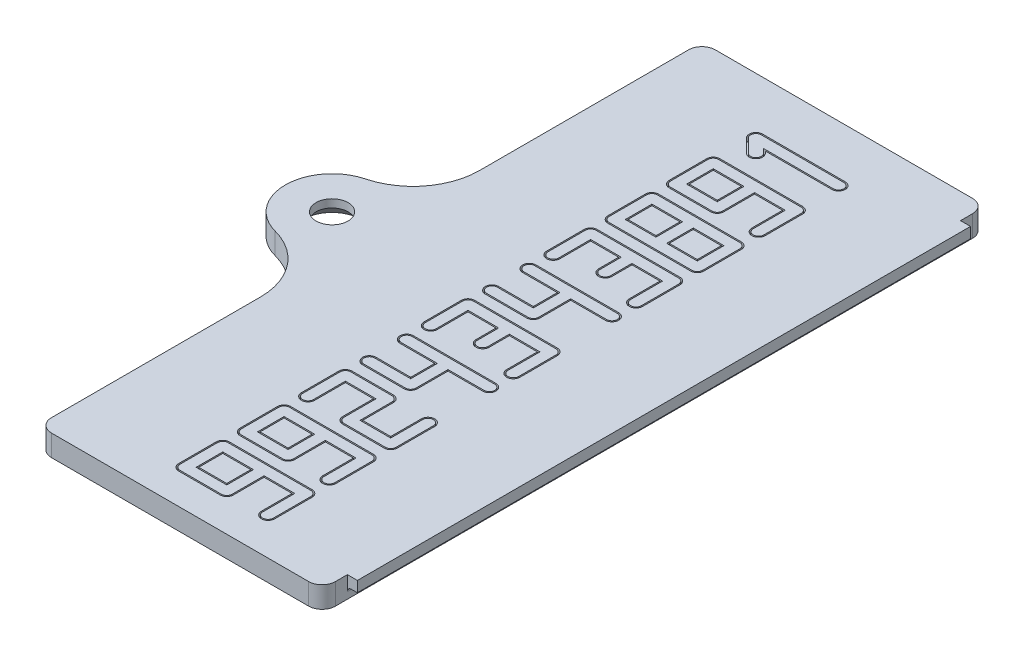
from build123d import *

# Parameters (mm, degrees)
DOOR_PLATE_1_6_SCREW_EAR_R5_R3_5_DEPTH        = 1.6
HOOK_FLANGE_0_75_X_0_8_INNER_FACE_P_2_W       = 0.9
HOOK_FLANGE_0_75_X_0_8_INNER_FACE_P_2_H       = 46
HOOK_FLANGE_0_75_X_0_8_INNER_FACE_PLANE_DEPTH = 0.8
SCREW_HOLE_2_4_FREE_SKETCH_R                  = 1.2
SCREW_HOLE_2_4_FREE_DEPTH                     = 73.114700304
SCREW_CSK_90DEG_M2_SIZE                       = 1
DOOR_CORNERS_R1_PRINT_R                       = 1
HOOK_FLANGE_ROOT_FILLET_R0_3_R                = 0.3
PHONE_NUMBER_9924343891_SLITS_0_8_STROK_DEPTH = 0.4
PHONE_NUMBER_COUNTER_SLITS_SKETCH_W           = 2.3
PHONE_NUMBER_COUNTER_SLITS_SKETCH_H           = 2
PHONE_NUMBER_COUNTER_SLITS_SKETCH_W_2         = 2.1
PHONE_NUMBER_COUNTER_SLITS_SKETCH_H_2         = 1.8
PHONE_NUMBER_COUNTER_SLITS_DEPTH              = 0.4


with BuildPart() as part:
    # Door Plate 1.6 + screw ear (R5 / R3.5) Sketch → Door Plate 1.6 + screw ear (R5 / R3.5) (new body)
    with BuildSketch(Plane(origin=(0, 0, 0), x_dir=(1, 0, 0), z_dir=(0, 1, 0))):
        with BuildLine():
            Line((9.35, 15.1), (30.65, 15.1))
            Line((30.65, 15.1), (30.65, 64.9))
            Line((30.65, 64.9), (9.35, 64.9))
            Line((9.35, 64.9), (9.35, 48.223594105))
            ThreePointArc((9.35, 48.223594105), (8.307494751, 45.167741475), (5.614705882, 43.386185808))
            ThreePointArc((5.614705882, 43.386185808), (3, 40), (5.614705882, 36.613814192))
            ThreePointArc((5.614705882, 36.613814192), (8.307494751, 34.832258525), (9.35, 31.776405895))
            Line((9.35, 31.776405895), (9.35, 15.1))
        make_face()
    extrude(amount=DOOR_PLATE_1_6_SCREW_EAR_R5_R3_5_DEPTH)

    # Hook Flange 0.75 x 0.8 _inner-face p 2 → Hook Flange 0.75 x 0.8 _inner-face plane (add)
    with BuildSketch(Plane(origin=(0, 0.8, 0), x_dir=(1, 0, 0), z_dir=(0, 1, 0))):
        with Locations((30.95, 40)):
            Rectangle(HOOK_FLANGE_0_75_X_0_8_INNER_FACE_P_2_W, HOOK_FLANGE_0_75_X_0_8_INNER_FACE_P_2_H)
    extrude(amount=HOOK_FLANGE_0_75_X_0_8_INNER_FACE_PLANE_DEPTH)

    # Screw Hole 2.4 (free) Sketch → Screw Hole 2.4 (free) (cut, through all)
    with BuildSketch(Plane(origin=(0, 0, 0), x_dir=(1, 0, 0), z_dir=(0, 1, 0))):
        with Locations((6.5, 40)):
            Circle(SCREW_HOLE_2_4_FREE_SKETCH_R)
    extrude(amount=SCREW_HOLE_2_4_FREE_DEPTH, mode=Mode.SUBTRACT)

    # Screw CSK 90deg (M2)
    screw_csk_90deg_m2_edges = [part.edges().sort_by_distance(p)[0] for p in [
        (5.3, 0, -40),
    ]]
    chamfer(screw_csk_90deg_m2_edges, length=SCREW_CSK_90DEG_M2_SIZE)

    # Door Corners R1 (print)
    door_corners_r1_print_edges = [part.edges().sort_by_distance(p)[0] for p in [
        (9.35, 0.8, -64.9),
        (30.65, 0.8, -64.9),
        (30.65, 0.8, -15.1),
        (9.35, 0.8, -15.1),
    ]]
    fillet(door_corners_r1_print_edges, radius=DOOR_CORNERS_R1_PRINT_R)

    # Hook Flange Root Fillet R0.3
    hook_flange_root_fillet_r0_3_edges = [part.edges().sort_by_distance(p)[0] for p in [
        (30.65, 0.8, -40),
    ]]
    fillet(hook_flange_root_fillet_r0_3_edges, radius=HOOK_FLANGE_ROOT_FILLET_R0_3_R)

    # Phone Number 9924343891 Slits _0.8 s 2 → Phone Number 9924343891 Slits _0.8 strok (cut)
    # profile 1 of 10: a face of its own
    with BuildSketch(Plane(origin=(0, 1.6, 0), x_dir=(1, 0, 0), z_dir=(0, 1, 0))):
        with BuildLine():
            Line((20.7, 17.4), (17.6, 17.4))
            ThreePointArc((17.6, 17.4), (17.246446609, 17.546446609), (17.1, 17.9))
            Line((17.1, 17.9), (17.1, 20.7))
            ThreePointArc((17.1, 20.7), (17.246446609, 21.053553391), (17.6, 21.2))
            Line((17.6, 21.2), (23.8, 21.2))
            ThreePointArc((23.8, 21.2), (24.153553391, 21.053553391), (24.3, 20.7))
            Line((24.3, 20.7), (24.3, 17.9))
            ThreePointArc((24.3, 17.9), (23.8, 17.4), (23.3, 17.9))
            Line((23.3, 17.9), (23.3, 20.2))
            Line((23.3, 20.2), (21.2, 20.2))
            Line((21.2, 20.2), (21.2, 17.9))
            ThreePointArc((21.2, 17.9), (21.053553391, 17.546446609), (20.7, 17.4))
        make_face()
        with BuildLine():
            Line((17.2, 20.7), (17.2, 17.9))
            ThreePointArc((17.2, 17.9), (17.317157288, 17.617157288), (17.6, 17.5))
            Line((17.6, 17.5), (20.7, 17.5))
            ThreePointArc((20.7, 17.5), (20.982842712, 17.617157288), (21.1, 17.9))
            Line((21.1, 17.9), (21.1, 20.3))
            Line((21.1, 20.3), (23.4, 20.3))
            Line((23.4, 20.3), (23.4, 17.9))
            ThreePointArc((23.4, 17.9), (23.8, 17.5), (24.2, 17.9))
            Line((24.2, 17.9), (24.2, 20.7))
            ThreePointArc((24.2, 20.7), (24.082842712, 20.982842712), (23.8, 21.1))
            Line((23.8, 21.1), (17.6, 21.1))
            ThreePointArc((17.6, 21.1), (17.317157288, 20.982842712), (17.2, 20.7))
        make_face(mode=Mode.SUBTRACT)
    # profile 2 of 10: a face of its own
    with BuildSketch(Plane(origin=(0, 1.6, 0), x_dir=(1, 0, 0), z_dir=(0, 1, 0))):
        with BuildLine():
            Line((20.7, 22), (17.6, 22))
            ThreePointArc((17.6, 22), (17.246446609, 22.146446609), (17.1, 22.5))
            Line((17.1, 22.5), (17.1, 25.3))
            ThreePointArc((17.1, 25.3), (17.246446609, 25.653553391), (17.6, 25.8))
            Line((17.6, 25.8), (23.8, 25.8))
            ThreePointArc((23.8, 25.8), (24.153553391, 25.653553391), (24.3, 25.3))
            Line((24.3, 25.3), (24.3, 22.5))
            ThreePointArc((24.3, 22.5), (23.8, 22), (23.3, 22.5))
            Line((23.3, 22.5), (23.3, 24.8))
            Line((23.3, 24.8), (21.2, 24.8))
            Line((21.2, 24.8), (21.2, 22.5))
            ThreePointArc((21.2, 22.5), (21.053553391, 22.146446609), (20.7, 22))
        make_face()
        with BuildLine():
            Line((17.2, 25.3), (17.2, 22.5))
            ThreePointArc((17.2, 22.5), (17.317157288, 22.217157288), (17.6, 22.1))
            Line((17.6, 22.1), (20.7, 22.1))
            ThreePointArc((20.7, 22.1), (20.982842712, 22.217157288), (21.1, 22.5))
            Line((21.1, 22.5), (21.1, 24.9))
            Line((21.1, 24.9), (23.4, 24.9))
            Line((23.4, 24.9), (23.4, 22.5))
            ThreePointArc((23.4, 22.5), (23.8, 22.1), (24.2, 22.5))
            Line((24.2, 22.5), (24.2, 25.3))
            ThreePointArc((24.2, 25.3), (24.082842712, 25.582842712), (23.8, 25.7))
            Line((23.8, 25.7), (17.6, 25.7))
            ThreePointArc((17.6, 25.7), (17.317157288, 25.582842712), (17.2, 25.3))
        make_face(mode=Mode.SUBTRACT)
    # profile 3 of 10: a face of its own
    with BuildSketch(Plane(origin=(0, 1.6, 0), x_dir=(1, 0, 0), z_dir=(0, 1, 0))):
        with BuildLine():
            Line((24.3, 29.9), (24.3, 27.1))
            ThreePointArc((24.3, 27.1), (24.153553391, 26.746446609), (23.8, 26.6))
            Line((23.8, 26.6), (20.7, 26.6))
            ThreePointArc((20.7, 26.6), (20.346446609, 26.746446609), (20.2, 27.1))
            Line((20.2, 27.1), (20.2, 29.4))
            Line((20.2, 29.4), (18.1, 29.4))
            Line((18.1, 29.4), (18.1, 27.1))
            ThreePointArc((18.1, 27.1), (17.6, 26.6), (17.1, 27.1))
            Line((17.1, 27.1), (17.1, 29.9))
            ThreePointArc((17.1, 29.9), (17.246446609, 30.253553391), (17.6, 30.4))
            Line((17.6, 30.4), (20.7, 30.4))
            ThreePointArc((20.7, 30.4), (21.053553391, 30.253553391), (21.2, 29.9))
            Line((21.2, 29.9), (21.2, 27.6))
            Line((21.2, 27.6), (23.3, 27.6))
            Line((23.3, 27.6), (23.3, 29.9))
            ThreePointArc((23.3, 29.9), (23.8, 30.4), (24.3, 29.9))
        make_face()
        with BuildLine():
            Line((18, 29.5), (18, 27.1))
            ThreePointArc((18, 27.1), (17.6, 26.7), (17.2, 27.1))
            Line((17.2, 27.1), (17.2, 29.9))
            ThreePointArc((17.2, 29.9), (17.317157288, 30.182842712), (17.6, 30.3))
            Line((17.6, 30.3), (20.7, 30.3))
            ThreePointArc((20.7, 30.3), (20.982842712, 30.182842712), (21.1, 29.9))
            Line((21.1, 29.9), (21.1, 27.5))
            Line((21.1, 27.5), (23.4, 27.5))
            Line((23.4, 27.5), (23.4, 29.9))
            ThreePointArc((23.4, 29.9), (23.8, 30.3), (24.2, 29.9))
            Line((24.2, 29.9), (24.2, 27.1))
            ThreePointArc((24.2, 27.1), (24.082842712, 26.817157288), (23.8, 26.7))
            Line((23.8, 26.7), (20.7, 26.7))
            ThreePointArc((20.7, 26.7), (20.417157288, 26.817157288), (20.3, 27.1))
            Line((20.3, 27.1), (20.3, 29.5))
            Line((20.3, 29.5), (18, 29.5))
        make_face(mode=Mode.SUBTRACT)
    # profile 4 of 10: a face of its own
    with BuildSketch(Plane(origin=(0, 1.6, 0), x_dir=(1, 0, 0), z_dir=(0, 1, 0))):
        with BuildLine():
            Line((23.8, 34), (21.2, 34))
            Line((21.2, 34), (21.2, 31.7))
            ThreePointArc((21.2, 31.7), (21.053553391, 31.346446609), (20.7, 31.2))
            Line((20.7, 31.2), (17.6, 31.2))
            ThreePointArc((17.6, 31.2), (17.1, 31.7), (17.6, 32.2))
            Line((17.6, 32.2), (20.2, 32.2))
            Line((20.2, 32.2), (20.2, 34))
            Line((20.2, 34), (17.6, 34))
            ThreePointArc((17.6, 34), (17.1, 34.5), (17.6, 35))
            Line((17.6, 35), (23.8, 35))
            ThreePointArc((23.8, 35), (24.153553391, 34.853553391), (24.3, 34.5))
            ThreePointArc((24.3, 34.5), (24.153553391, 34.146446609), (23.8, 34))
        make_face()
        with BuildLine():
            Line((21.1, 31.7), (21.1, 34.1))
            Line((21.1, 34.1), (23.8, 34.1))
            ThreePointArc((23.8, 34.1), (24.082842712, 34.217157288), (24.2, 34.5))
            ThreePointArc((24.2, 34.5), (24.082842712, 34.782842712), (23.8, 34.9))
            Line((23.8, 34.9), (17.6, 34.9))
            ThreePointArc((17.6, 34.9), (17.2, 34.5), (17.6, 34.1))
            Line((17.6, 34.1), (20.3, 34.1))
            Line((20.3, 34.1), (20.3, 32.1))
            Line((20.3, 32.1), (17.6, 32.1))
            ThreePointArc((17.6, 32.1), (17.2, 31.7), (17.6, 31.3))
            Line((17.6, 31.3), (20.7, 31.3))
            ThreePointArc((20.7, 31.3), (20.982842712, 31.417157288), (21.1, 31.7))
        make_face(mode=Mode.SUBTRACT)
    # profile 5 of 10: a face of its own
    with BuildSketch(Plane(origin=(0, 1.6, 0), x_dir=(1, 0, 0), z_dir=(0, 1, 0))):
        with BuildLine():
            Line((23.3, 36.3), (23.3, 38.6))
            Line((23.3, 38.6), (21.2, 38.6))
            Line((21.2, 38.6), (21.2, 37.1))
            ThreePointArc((21.2, 37.1), (20.7, 36.6), (20.2, 37.1))
            Line((20.2, 37.1), (20.2, 38.6))
            Line((20.2, 38.6), (18.1, 38.6))
            Line((18.1, 38.6), (18.1, 36.3))
            ThreePointArc((18.1, 36.3), (17.6, 35.8), (17.1, 36.3))
            Line((17.1, 36.3), (17.1, 39.1))
            ThreePointArc((17.1, 39.1), (17.246446609, 39.453553391), (17.6, 39.6))
            Line((17.6, 39.6), (23.8, 39.6))
            ThreePointArc((23.8, 39.6), (24.153553391, 39.453553391), (24.3, 39.1))
            Line((24.3, 39.1), (24.3, 36.3))
            ThreePointArc((24.3, 36.3), (23.8, 35.8), (23.3, 36.3))
        make_face()
        with BuildLine():
            Line((17.2, 36.3), (17.2, 39.1))
            ThreePointArc((17.2, 39.1), (17.317157288, 39.382842712), (17.6, 39.5))
            Line((17.6, 39.5), (23.8, 39.5))
            ThreePointArc((23.8, 39.5), (24.082842712, 39.382842712), (24.2, 39.1))
            Line((24.2, 39.1), (24.2, 36.3))
            ThreePointArc((24.2, 36.3), (23.8, 35.9), (23.4, 36.3))
            Line((23.4, 36.3), (23.4, 38.7))
            Line((23.4, 38.7), (21.1, 38.7))
            Line((21.1, 38.7), (21.1, 37.1))
            ThreePointArc((21.1, 37.1), (20.7, 36.7), (20.3, 37.1))
            Line((20.3, 37.1), (20.3, 38.7))
            Line((20.3, 38.7), (18, 38.7))
            Line((18, 38.7), (18, 36.3))
            ThreePointArc((18, 36.3), (17.6, 35.9), (17.2, 36.3))
        make_face(mode=Mode.SUBTRACT)
    # profile 6 of 10: a face of its own
    with BuildSketch(Plane(origin=(0, 1.6, 0), x_dir=(1, 0, 0), z_dir=(0, 1, 0))):
        with BuildLine():
            Line((23.8, 43.2), (21.2, 43.2))
            Line((21.2, 43.2), (21.2, 40.9))
            ThreePointArc((21.2, 40.9), (21.053553391, 40.546446609), (20.7, 40.4))
            Line((20.7, 40.4), (17.6, 40.4))
            ThreePointArc((17.6, 40.4), (17.1, 40.9), (17.6, 41.4))
            Line((17.6, 41.4), (20.2, 41.4))
            Line((20.2, 41.4), (20.2, 43.2))
            Line((20.2, 43.2), (17.6, 43.2))
            ThreePointArc((17.6, 43.2), (17.1, 43.7), (17.6, 44.2))
            Line((17.6, 44.2), (23.8, 44.2))
            ThreePointArc((23.8, 44.2), (24.153553391, 44.053553391), (24.3, 43.7))
            ThreePointArc((24.3, 43.7), (24.153553391, 43.346446609), (23.8, 43.2))
        make_face()
        with BuildLine():
            Line((21.1, 40.9), (21.1, 43.3))
            Line((21.1, 43.3), (23.8, 43.3))
            ThreePointArc((23.8, 43.3), (24.082842712, 43.417157288), (24.2, 43.7))
            ThreePointArc((24.2, 43.7), (24.082842712, 43.982842712), (23.8, 44.1))
            Line((23.8, 44.1), (17.6, 44.1))
            ThreePointArc((17.6, 44.1), (17.2, 43.7), (17.6, 43.3))
            Line((17.6, 43.3), (20.3, 43.3))
            Line((20.3, 43.3), (20.3, 41.3))
            Line((20.3, 41.3), (17.6, 41.3))
            ThreePointArc((17.6, 41.3), (17.2, 40.9), (17.6, 40.5))
            Line((17.6, 40.5), (20.7, 40.5))
            ThreePointArc((20.7, 40.5), (20.982842712, 40.617157288), (21.1, 40.9))
        make_face(mode=Mode.SUBTRACT)
    # profile 7 of 10: a face of its own
    with BuildSketch(Plane(origin=(0, 1.6, 0), x_dir=(1, 0, 0), z_dir=(0, 1, 0))):
        with BuildLine():
            Line((23.3, 45.5), (23.3, 47.8))
            Line((23.3, 47.8), (21.2, 47.8))
            Line((21.2, 47.8), (21.2, 46.3))
            ThreePointArc((21.2, 46.3), (20.7, 45.8), (20.2, 46.3))
            Line((20.2, 46.3), (20.2, 47.8))
            Line((20.2, 47.8), (18.1, 47.8))
            Line((18.1, 47.8), (18.1, 45.5))
            ThreePointArc((18.1, 45.5), (17.6, 45), (17.1, 45.5))
            Line((17.1, 45.5), (17.1, 48.3))
            ThreePointArc((17.1, 48.3), (17.246446609, 48.653553391), (17.6, 48.8))
            Line((17.6, 48.8), (23.8, 48.8))
            ThreePointArc((23.8, 48.8), (24.153553391, 48.653553391), (24.3, 48.3))
            Line((24.3, 48.3), (24.3, 45.5))
            ThreePointArc((24.3, 45.5), (23.8, 45), (23.3, 45.5))
        make_face()
        with BuildLine():
            Line((17.2, 45.5), (17.2, 48.3))
            ThreePointArc((17.2, 48.3), (17.317157288, 48.582842712), (17.6, 48.7))
            Line((17.6, 48.7), (23.8, 48.7))
            ThreePointArc((23.8, 48.7), (24.082842712, 48.582842712), (24.2, 48.3))
            Line((24.2, 48.3), (24.2, 45.5))
            ThreePointArc((24.2, 45.5), (23.8, 45.1), (23.4, 45.5))
            Line((23.4, 45.5), (23.4, 47.9))
            Line((23.4, 47.9), (21.1, 47.9))
            Line((21.1, 47.9), (21.1, 46.3))
            ThreePointArc((21.1, 46.3), (20.7, 45.9), (20.3, 46.3))
            Line((20.3, 46.3), (20.3, 47.9))
            Line((20.3, 47.9), (18, 47.9))
            Line((18, 47.9), (18, 45.5))
            ThreePointArc((18, 45.5), (17.6, 45.1), (17.2, 45.5))
        make_face(mode=Mode.SUBTRACT)
    # profile 8 of 10: a face of its own
    with BuildSketch(Plane(origin=(0, 1.6, 0), x_dir=(1, 0, 0), z_dir=(0, 1, 0))):
        with BuildLine():
            Line((24.3, 52.9), (24.3, 50.1))
            ThreePointArc((24.3, 50.1), (24.153553391, 49.746446609), (23.8, 49.6))
            Line((23.8, 49.6), (17.6, 49.6))
            ThreePointArc((17.6, 49.6), (17.246446609, 49.746446609), (17.1, 50.1))
            Line((17.1, 50.1), (17.1, 52.9))
            ThreePointArc((17.1, 52.9), (17.246446609, 53.253553391), (17.6, 53.4))
            Line((17.6, 53.4), (23.8, 53.4))
            ThreePointArc((23.8, 53.4), (24.153553391, 53.253553391), (24.3, 52.9))
        make_face()
        with BuildLine():
            Line((24.2, 50.1), (24.2, 52.9))
            ThreePointArc((24.2, 52.9), (24.082842712, 53.182842712), (23.8, 53.3))
            Line((23.8, 53.3), (17.6, 53.3))
            ThreePointArc((17.6, 53.3), (17.317157288, 53.182842712), (17.2, 52.9))
            Line((17.2, 52.9), (17.2, 50.1))
            ThreePointArc((17.2, 50.1), (17.317157288, 49.817157288), (17.6, 49.7))
            Line((17.6, 49.7), (23.8, 49.7))
            ThreePointArc((23.8, 49.7), (24.082842712, 49.817157288), (24.2, 50.1))
        make_face(mode=Mode.SUBTRACT)
    # profile 9 of 10: a face of its own
    with BuildSketch(Plane(origin=(0, 1.6, 0), x_dir=(1, 0, 0), z_dir=(0, 1, 0))):
        with BuildLine():
            Line((20.7, 54.2), (17.6, 54.2))
            ThreePointArc((17.6, 54.2), (17.246446609, 54.346446609), (17.1, 54.7))
            Line((17.1, 54.7), (17.1, 57.5))
            ThreePointArc((17.1, 57.5), (17.246446609, 57.853553391), (17.6, 58))
            Line((17.6, 58), (23.8, 58))
            ThreePointArc((23.8, 58), (24.153553391, 57.853553391), (24.3, 57.5))
            Line((24.3, 57.5), (24.3, 54.7))
            ThreePointArc((24.3, 54.7), (23.8, 54.2), (23.3, 54.7))
            Line((23.3, 54.7), (23.3, 57))
            Line((23.3, 57), (21.2, 57))
            Line((21.2, 57), (21.2, 54.7))
            ThreePointArc((21.2, 54.7), (21.053553391, 54.346446609), (20.7, 54.2))
        make_face()
        with BuildLine():
            Line((17.2, 57.5), (17.2, 54.7))
            ThreePointArc((17.2, 54.7), (17.317157288, 54.417157288), (17.6, 54.3))
            Line((17.6, 54.3), (20.7, 54.3))
            ThreePointArc((20.7, 54.3), (20.982842712, 54.417157288), (21.1, 54.7))
            Line((21.1, 54.7), (21.1, 57.1))
            Line((21.1, 57.1), (23.4, 57.1))
            Line((23.4, 57.1), (23.4, 54.7))
            ThreePointArc((23.4, 54.7), (23.8, 54.3), (24.2, 54.7))
            Line((24.2, 54.7), (24.2, 57.5))
            ThreePointArc((24.2, 57.5), (24.082842712, 57.782842712), (23.8, 57.9))
            Line((23.8, 57.9), (17.6, 57.9))
            ThreePointArc((17.6, 57.9), (17.317157288, 57.782842712), (17.2, 57.5))
        make_face(mode=Mode.SUBTRACT)
    # profile 10 of 10: a face of its own
    with BuildSketch(Plane(origin=(0, 1.6, 0), x_dir=(1, 0, 0), z_dir=(0, 1, 0))):
        with BuildLine():
            Line((17.6, 61.2), (23.8, 61.2))
            ThreePointArc((23.8, 61.2), (24.153553391, 61.053553391), (24.3, 60.7))
            ThreePointArc((24.3, 60.7), (24.153553391, 60.346446609), (23.8, 60.2))
            Line((23.8, 60.2), (18.807106781, 60.2))
            Line((18.807106781, 60.2), (18.953553391, 60.053553391))
            ThreePointArc((18.953553391, 60.053553391), (19.061939766, 59.891341716), (19.1, 59.7))
            ThreePointArc((19.1, 59.7), (18.791341716, 59.238060234), (18.246446609, 59.346446609))
            Line((18.246446609, 59.346446609), (17.246446609, 60.346446609))
            ThreePointArc((17.246446609, 60.346446609), (17.138060234, 60.891341716), (17.6, 61.2))
        make_face()
        with BuildLine():
            Line((18.565685425, 60.3), (18.882842712, 59.982842712))
            ThreePointArc((18.882842712, 59.982842712), (18.969551813, 59.853073373), (19, 59.7))
            ThreePointArc((19, 59.7), (18.753073373, 59.330448187), (18.317157288, 59.417157288))
            Line((18.317157288, 59.417157288), (17.317157288, 60.417157288))
            ThreePointArc((17.317157288, 60.417157288), (17.230448187, 60.853073373), (17.6, 61.1))
            Line((17.6, 61.1), (23.8, 61.1))
            ThreePointArc((23.8, 61.1), (24.082842712, 60.982842712), (24.2, 60.7))
            ThreePointArc((24.2, 60.7), (24.082842712, 60.417157288), (23.8, 60.3))
            Line((23.8, 60.3), (18.565685425, 60.3))
        make_face(mode=Mode.SUBTRACT)
    extrude(amount=-PHONE_NUMBER_9924343891_SLITS_0_8_STROK_DEPTH, mode=Mode.SUBTRACT)

    # Phone Number Counter Slits Sketch → Phone Number Counter Slits (cut)
    # profile 1 of 5: a face of its own
    with BuildSketch(Plane(origin=(0, 1.6, 0), x_dir=(1, 0, 0), z_dir=(0, 1, 0))):
        with Locations((19.15, 19.3)):
            Rectangle(PHONE_NUMBER_COUNTER_SLITS_SKETCH_W, PHONE_NUMBER_COUNTER_SLITS_SKETCH_H)
        with Locations((19.15, 19.3)):
            Rectangle(PHONE_NUMBER_COUNTER_SLITS_SKETCH_W_2, PHONE_NUMBER_COUNTER_SLITS_SKETCH_H_2, mode=Mode.SUBTRACT)
    # profile 2 of 5: a face of its own
    with BuildSketch(Plane(origin=(0, 1.6, 0), x_dir=(1, 0, 0), z_dir=(0, 1, 0))):
        with Locations((19.15, 23.9)):
            Rectangle(PHONE_NUMBER_COUNTER_SLITS_SKETCH_W, PHONE_NUMBER_COUNTER_SLITS_SKETCH_H)
        with Locations((19.15, 23.9)):
            Rectangle(PHONE_NUMBER_COUNTER_SLITS_SKETCH_W_2, PHONE_NUMBER_COUNTER_SLITS_SKETCH_H_2, mode=Mode.SUBTRACT)
    # profile 3 of 5: a face of its own
    with BuildSketch(Plane(origin=(0, 1.6, 0), x_dir=(1, 0, 0), z_dir=(0, 1, 0))):
        with Locations((22.25, 51.5)):
            Rectangle(PHONE_NUMBER_COUNTER_SLITS_SKETCH_W, PHONE_NUMBER_COUNTER_SLITS_SKETCH_H)
        with Locations((22.25, 51.5)):
            Rectangle(PHONE_NUMBER_COUNTER_SLITS_SKETCH_W_2, PHONE_NUMBER_COUNTER_SLITS_SKETCH_H_2, mode=Mode.SUBTRACT)
    # profile 4 of 5: a face of its own
    with BuildSketch(Plane(origin=(0, 1.6, 0), x_dir=(1, 0, 0), z_dir=(0, 1, 0))):
        with Locations((19.15, 51.5)):
            Rectangle(PHONE_NUMBER_COUNTER_SLITS_SKETCH_W, PHONE_NUMBER_COUNTER_SLITS_SKETCH_H)
        with Locations((19.15, 51.5)):
            Rectangle(PHONE_NUMBER_COUNTER_SLITS_SKETCH_W_2, PHONE_NUMBER_COUNTER_SLITS_SKETCH_H_2, mode=Mode.SUBTRACT)
    # profile 5 of 5: a face of its own
    with BuildSketch(Plane(origin=(0, 1.6, 0), x_dir=(1, 0, 0), z_dir=(0, 1, 0))):
        with Locations((19.15, 56.1)):
            Rectangle(PHONE_NUMBER_COUNTER_SLITS_SKETCH_W, PHONE_NUMBER_COUNTER_SLITS_SKETCH_H)
        with Locations((19.15, 56.1)):
            Rectangle(PHONE_NUMBER_COUNTER_SLITS_SKETCH_W_2, PHONE_NUMBER_COUNTER_SLITS_SKETCH_H_2, mode=Mode.SUBTRACT)
    extrude(amount=-PHONE_NUMBER_COUNTER_SLITS_DEPTH, mode=Mode.SUBTRACT)


solid = part.part
